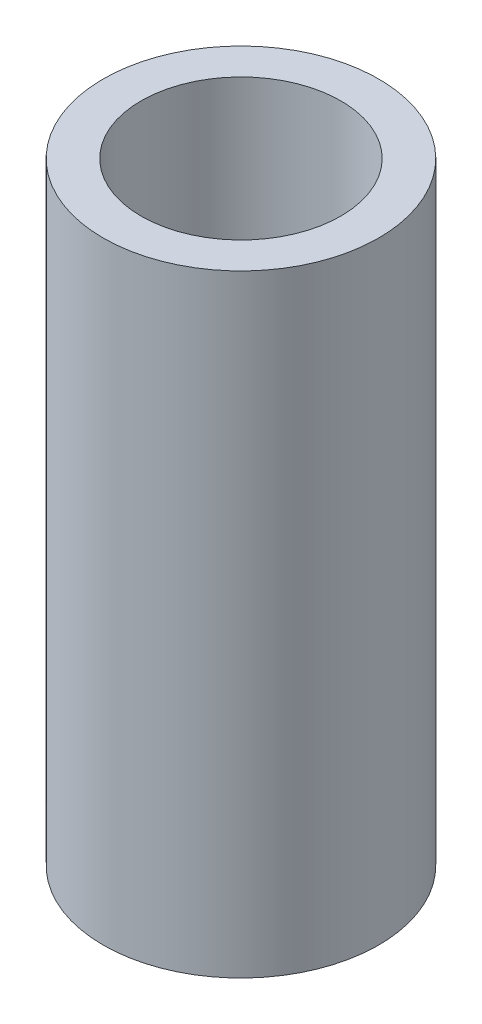
from build123d import *

# Parameters (mm, degrees)
SKETCH1_R           = 2
SKETCH1_R_2         = 1.45
BOSS_EXTRUDE1_DEPTH = 8.89


with BuildPart() as part:
    # Sketch1 → Boss-Extrude1 (new body)
    with BuildSketch(Plane(origin=(0, 0, 0), x_dir=(1, 0, 0), z_dir=(0, 1, 0))):
        Circle(SKETCH1_R)
        Circle(SKETCH1_R_2, mode=Mode.SUBTRACT)
    extrude(amount=BOSS_EXTRUDE1_DEPTH)


solid = part.part
